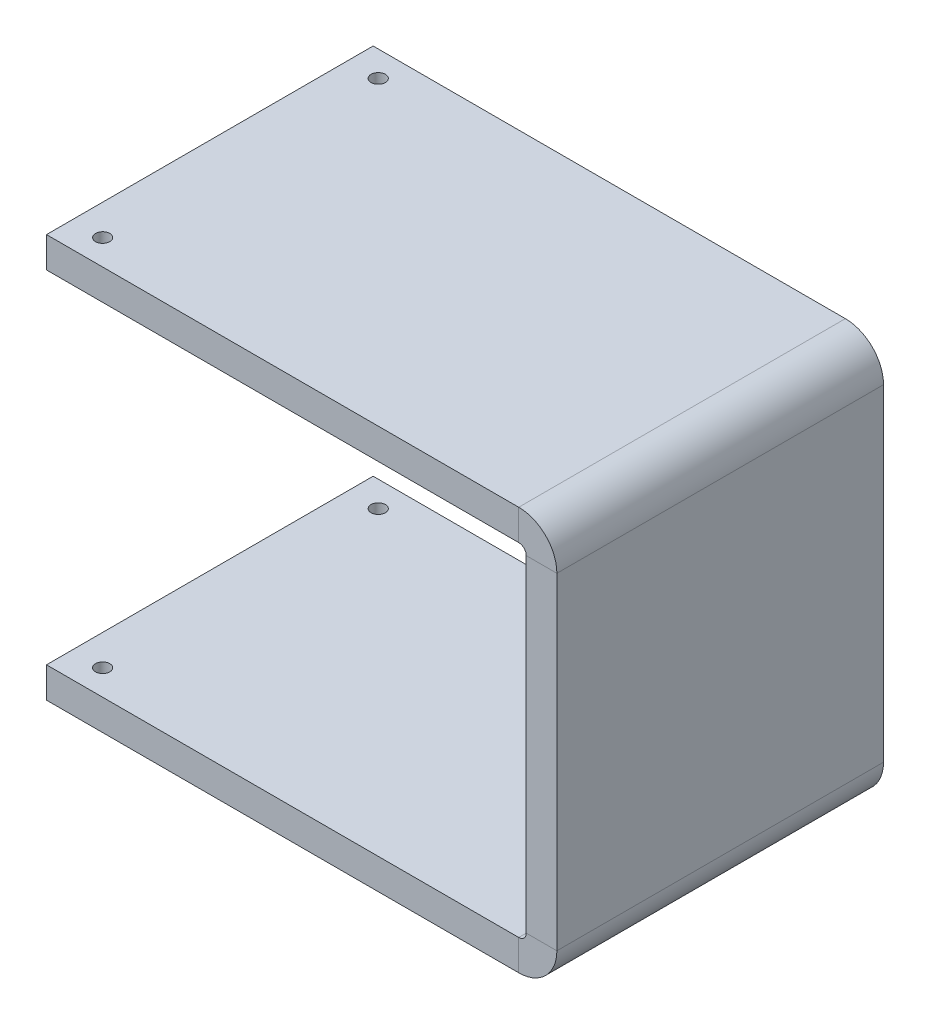
from build123d import *

# Parameters (mm, degrees)
T_LE_DE_BASE_PLI_E1_DEPTH = 32
ESQUISSE6_R               = 0.7
ENL_V_MAT_EXTRU_1_DEPTH   = 72.303926961


# Sheet-metal steps are written as plain solids
with BuildPart() as part:
    # Esquisse1 → Tôle de base pliée1 (new body)
    with BuildSketch(Plane.XY):
        with BuildLine():
            Line((-50, 19.75), (-3.7366, 19.75))
            ThreePointArc((-3.7366, 19.75), (-1.094424801, 18.655575199), (0, 16.0134))
            Line((0, 16.0134), (0, -16.0134))
            ThreePointArc((0, -16.0134), (-1.094424801, -18.655575199), (-3.7366, -19.75))
            Line((-3.7366, -19.75), (-50, -19.75))
            Line((-50, -19.75), (-50, -16.75))
            Line((-50, -16.75), (-3.7366, -16.75))
            ThreePointArc((-3.7366, -16.75), (-3.215745145, -16.534254855), (-3, -16.0134))
            Line((-3, -16.0134), (-3, 16.0134))
            ThreePointArc((-3, 16.0134), (-3.215745145, 16.534254855), (-3.7366, 16.75))
            Line((-3.7366, 16.75), (-50, 16.75))
            Line((-50, 16.75), (-50, 19.75))
        make_face()
    extrude(amount=T_LE_DE_BASE_PLI_E1_DEPTH)

    # Esquisse6 → Enlèv. mat.-Extru.1 (cut, through all)
    with BuildSketch(Plane(origin=(0, 19.75, 0), x_dir=(1, 0, 0), z_dir=(0, 1, 0))):
        with Locations(Location((-47, -2.5, 0), (0, 0, 270))):
            Circle(ESQUISSE6_R)
        with Locations(Location((-47, -29.5, 0), (0, 0, 270))):
            Circle(ESQUISSE6_R)
    extrude(amount=-ENL_V_MAT_EXTRU_1_DEPTH, mode=Mode.SUBTRACT)


solid = part.part
